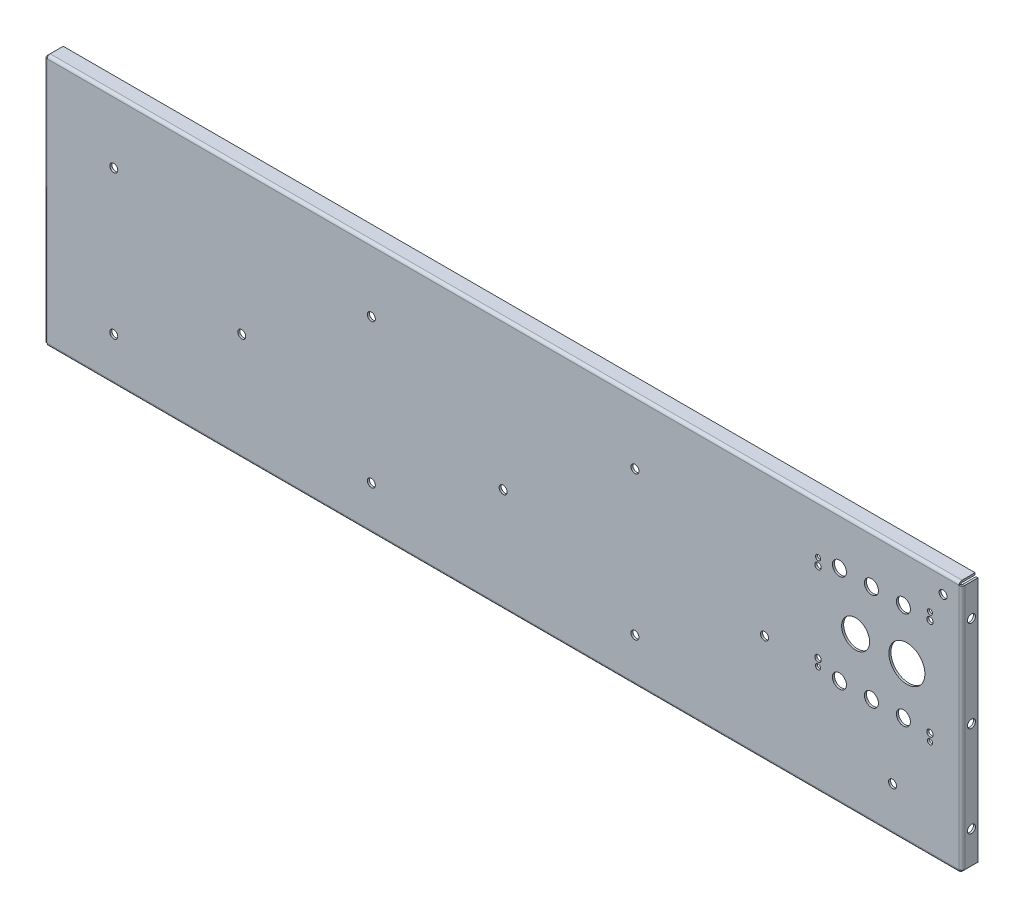
from build123d import *

# Parameters (mm, degrees)
SKETCH1_W                    = 723.9
SKETCH1_H                    = 200.152
BASE_FLANGE1_DEPTH           = 1.6002
EDGE_FLANGE1_STRIP_W         = 7.874
EDGE_FLANGE1_STRIP_H         = 1.6002
EDGE_FLANGE1_STRIP_CUT_DEPTH = 723.9
EDGE_FLANGE1_DEPTH           = 723.9
EDGE_FLANGE2_STRIP_W         = 7.874
EDGE_FLANGE2_STRIP_H         = 1.6002
EDGE_FLANGE2_STRIP_CUT_DEPTH = 723.9
EDGE_FLANGE2_DEPTH           = 723.9
SKETCH12_R                   = 3.175
SKETCH12_R_2                 = 14.2875
CUT_EXTRUDE1_DEPTH           = 376.694309028
SKETCH13_R                   = 3.175
CUT_EXTRUDE2_DEPTH           = 391.850505532
EDGE_FLANGE3_DEPTH           = 195.4784
EDGE_FLANGE3_BEND_DEPTH      = 195.4784
SKETCH20_R                   = 3.175
CUT_EXTRUDE3_DEPTH           = 736.524293544
SKETCH22_R                   = 5.55625
SKETCH22_R_2                 = 2.5527
SKETCH22_R_3                 = 2.0447
SKETCH22_R_4                 = 11.10615
CUT_EXTRUDE4_DEPTH           = 378.996519072
SKETCH23_R                   = 3.175
CUT_EXTRUDE5_DEPTH           = 378.946139007


# Sheet-metal steps are written as plain solids
with BuildPart() as part:
    # Sketch1 → Base-Flange1 (new body)
    with BuildSketch(Plane.XY):
        Rectangle(SKETCH1_W, SKETCH1_H)
    extrude(amount=-BASE_FLANGE1_DEPTH)

    # Edge-Flange1 strip (across the edge) → Edge-Flange1 strip cut (cut)
    with BuildSketch(Plane(origin=(-361.95, 100.076, -1.6002), x_dir=(0, -1, 0), z_dir=(1, 0, 0))):
        with Locations((-1.6002, -0.8001)):
            Rectangle(EDGE_FLANGE1_STRIP_W, EDGE_FLANGE1_STRIP_H)
    extrude(amount=EDGE_FLANGE1_STRIP_CUT_DEPTH, mode=Mode.SUBTRACT)

    # Edge-Flange1 section (across the edge) → Edge-Flange1 (add)
    with BuildSketch(Plane(origin=(-361.95, 100.076, -1.6002), x_dir=(0, -1, 0), z_dir=(1, 0, 0))):
        with BuildLine():
            Line((0, 0.7366), (0, 11.0998))
            Line((0, 11.0998), (1.6002, 11.0998))
            Line((1.6002, 11.0998), (1.6002, 0.7366))
            ThreePointArc((1.6002, 0.7366), (1.815945145, 0.215745145), (2.3368, 0))
            Line((2.3368, 0), (2.3368, -1.6002))
            ThreePointArc((2.3368, -1.6002), (0.684432874, -0.915767126), (0, 0.7366))
        make_face()
    extrude(amount=EDGE_FLANGE1_DEPTH)

    # Edge-Flange2 strip (across the edge) → Edge-Flange2 strip cut (cut)
    with BuildSketch(Plane(origin=(361.95, -100.076, -1.6002), x_dir=(0, 1, 0), z_dir=(-1, 0, 0))):
        with Locations((-1.6002, -0.8001)):
            Rectangle(EDGE_FLANGE2_STRIP_W, EDGE_FLANGE2_STRIP_H)
    extrude(amount=EDGE_FLANGE2_STRIP_CUT_DEPTH, mode=Mode.SUBTRACT)

    # Edge-Flange2 section (across the edge) → Edge-Flange2 (add)
    with BuildSketch(Plane(origin=(361.95, -100.076, -1.6002), x_dir=(0, 1, 0), z_dir=(-1, 0, 0))):
        with BuildLine():
            Line((0, 0.7366), (0, 11.0998))
            Line((0, 11.0998), (1.6002, 11.0998))
            Line((1.6002, 11.0998), (1.6002, 0.7366))
            ThreePointArc((1.6002, 0.7366), (1.815945145, 0.215745145), (2.3368, 0))
            Line((2.3368, 0), (2.3368, -1.6002))
            ThreePointArc((2.3368, -1.6002), (0.684432874, -0.915767126), (0, 0.7366))
        make_face()
    extrude(amount=EDGE_FLANGE2_DEPTH)

    # Sketch12 → Cut-Extrude1 (cut, through all)
    with BuildSketch(Plane(origin=(0, 0, -1.6002), x_dir=(-1, 0, 0), z_dir=(0, 0, -1))):
        with Locations((-207.518, -14.351)):
            Circle(SKETCH12_R)
        with Locations((0, -17.526)):
            Circle(SKETCH12_R)
        with Locations((207.518, -14.351)):
            Circle(SKETCH12_R)
        with Locations((-320.548, 23.268449438)):
            Circle(SKETCH12_R_2)
    extrude(amount=-CUT_EXTRUDE1_DEPTH, mode=Mode.SUBTRACT)

    # Sketch13 → Cut-Extrude2 (cut, through all)
    with BuildSketch(Plane(origin=(0, 0, -108.356399896), x_dir=(-1, 0, 0), z_dir=(0, 0, -1))):
        with Locations(Location((-309.118, -65.151, 0), (0, 0, 90))):
            Circle(SKETCH13_R)
        with Locations(Location((-104.638118017, -65.151, 0), (0, 0, 90))):
            Circle(SKETCH13_R)
        with Locations(Location((-104.638118017, 49.149, 0), (0, 0, 90))):
            Circle(SKETCH13_R)
        with Locations(Location((104.638118017, 49.149, 0), (0, 0, 90))):
            Circle(SKETCH13_R)
        with Locations(Location((104.638118017, -65.151, 0), (0, 0, 90))):
            Circle(SKETCH13_R)
        with Locations(Location((309.118, -65.151, 0), (0, 0, 90))):
            Circle(SKETCH13_R)
        with Locations(Location((309.118, 49.149, 0), (0, 0, 90))):
            Circle(SKETCH13_R)
    extrude(amount=-CUT_EXTRUDE2_DEPTH, mode=Mode.SUBTRACT)

    # Edge-Flange3 section (across the edge) → Edge-Flange3 (add)
    with BuildSketch(Plane(origin=(-362.6866, -97.7392, -1.6002), x_dir=(1, 0, 0), z_dir=(0, 1, 0))):
        with BuildLine():
            Line((-1.6002, 0.7366), (-1.6002, 11.0998))
            Line((-1.6002, 11.0998), (0, 11.0998))
            Line((0, 11.0998), (0, 0.7366))
            ThreePointArc((0, 0.7366), (0.215745145, 0.215745145), (0.7366, 0))
            Line((0.7366, 0), (0.7366, -1.6002))
            ThreePointArc((0.7366, -1.6002), (-0.915767126, -0.915767126), (-1.6002, 0.7366))
        make_face()
    extrude(amount=EDGE_FLANGE3_DEPTH)

    # Edge-Flange3 section 2 (across the edge) → Edge-Flange3 bend (add)
    with BuildSketch(Plane(origin=(362.6866, 97.7392, -1.6002), x_dir=(-1, 0, 0), z_dir=(0, -1, 0))):
        with BuildLine():
            Line((-1.6002, 0.7366), (-1.6002, 11.0998))
            Line((-1.6002, 11.0998), (0, 11.0998))
            Line((0, 11.0998), (0, 0.7366))
            ThreePointArc((0, 0.7366), (0.215745145, 0.215745145), (0.7366, 0))
            Line((0.7366, 0), (0.7366, -1.6002))
            ThreePointArc((0.7366, -1.6002), (-0.915767126, -0.915767126), (-1.6002, 0.7366))
        make_face()
    extrude(amount=EDGE_FLANGE3_BEND_DEPTH)

    # Sketch20 → Cut-Extrude3 (cut, through all)
    with BuildSketch(Plane.ZY.offset(364.2868)):
        with Locations((-7.5184, 72.3392)):
            Circle(SKETCH20_R)
        with Locations((-7.5184, 0)):
            Circle(SKETCH20_R)
        with Locations((-7.5184, -72.3392)):
            Circle(SKETCH20_R)
    extrude(amount=-CUT_EXTRUDE3_DEPTH, mode=Mode.SUBTRACT)

    # Sketch22 → Cut-Extrude4 (cut, through all)
    with BuildSketch(Plane.XY):
        with Locations((266.978063087, -15.466550562)):
            Circle(SKETCH22_R)
        with Locations((249.960063087, -8.481550562)):
            Circle(SKETCH22_R_2)
        with Locations((249.960063087, -14.323550562)):
            Circle(SKETCH22_R_3)
        with Locations((249.960063087, 55.018449438)):
            Circle(SKETCH22_R_2)
        with Locations((249.960063087, 60.860449438)):
            Circle(SKETCH22_R_3)
        with Locations((266.978063087, 62.003449438)):
            Circle(SKETCH22_R)
        with Locations((292.378063087, 62.003449438)):
            Circle(SKETCH22_R)
        with Locations((317.778063087, 62.003449438)):
            Circle(SKETCH22_R)
        with Locations((338.860063087, 62.003449438)):
            Circle(SKETCH22_R_2)
        with Locations((338.860063087, 67.845449438)):
            Circle(SKETCH22_R_3)
        with Locations((338.860063087, -15.466550562)):
            Circle(SKETCH22_R_2)
        with Locations((338.860063087, -21.308550562)):
            Circle(SKETCH22_R_3)
        with Locations((279.8318, 23.268449438)):
            Circle(SKETCH22_R_4)
        with Locations((292.378063087, -15.466550562)):
            Circle(SKETCH22_R)
        with Locations((317.778063087, -15.466550562)):
            Circle(SKETCH22_R)
    extrude(amount=-CUT_EXTRUDE4_DEPTH, mode=Mode.SUBTRACT)

    # Sketch23 → Cut-Extrude5 (cut, through all)
    with BuildSketch(Plane(origin=(0, 0, -1.6002), x_dir=(-1, 0, 0), z_dir=(0, 0, -1))):
        with Locations((-349.25, 85.0392)):
            Circle(SKETCH23_R)
    extrude(amount=-CUT_EXTRUDE5_DEPTH, mode=Mode.SUBTRACT)


solid = part.part
